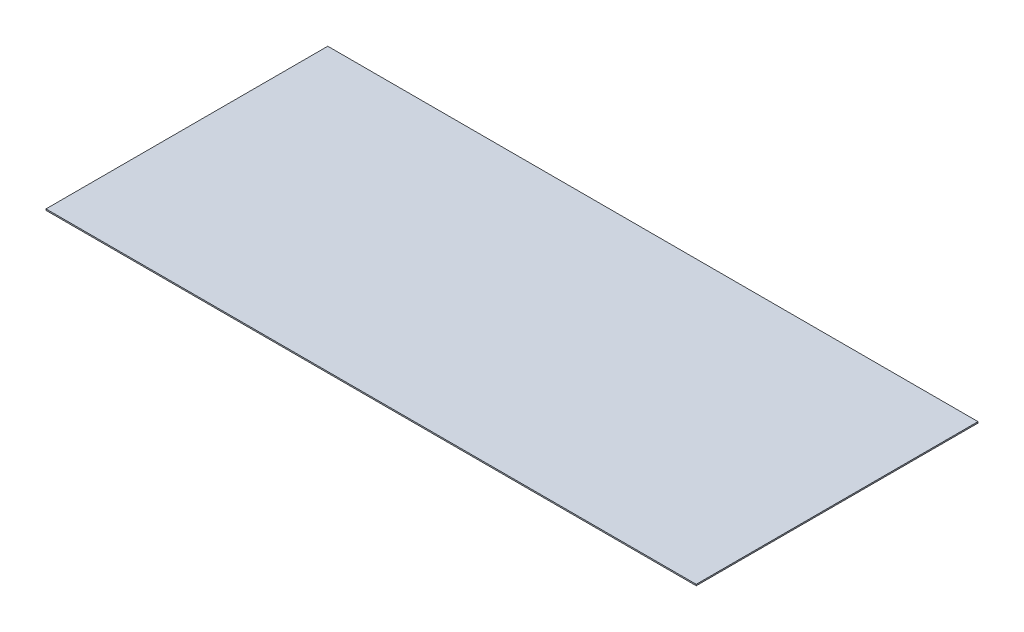
from build123d import *

# Parameters (mm, degrees)
SKETCH1_W          = 600
SKETCH1_H          = 260
BASE_FLANGE1_DEPTH = 1.2


# Sheet-metal steps are written as plain solids
with BuildPart() as part:
    # Sketch1 → Base-Flange1 (new body)
    with BuildSketch(Plane(origin=(0, 0, 0), x_dir=(1, 0, 0), z_dir=(0, 1, 0))):
        Rectangle(SKETCH1_W, SKETCH1_H)
    extrude(amount=-BASE_FLANGE1_DEPTH)


solid = part.part
